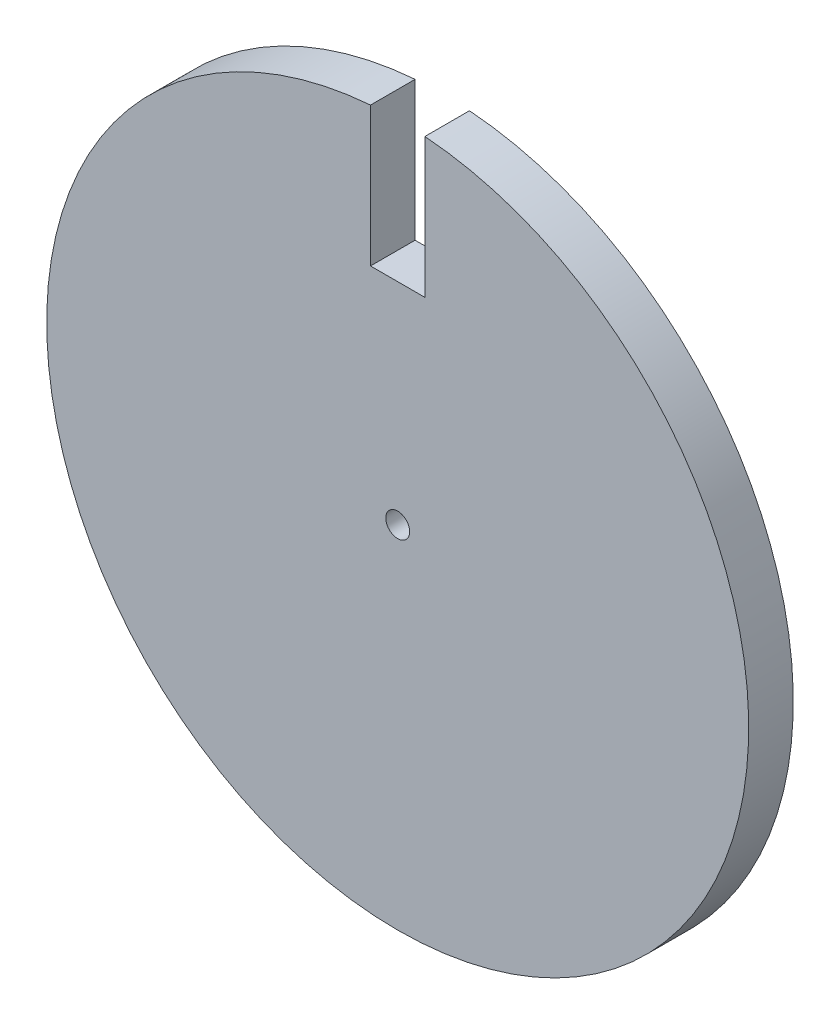
from build123d import *

# Parameters (mm, degrees)
SKETCH1_R           = 25
SKETCH1_R_2         = 0.85
BOSS_EXTRUDE1_DEPTH = 3.175
CUT_EXTRUDE1_REACH  = 37.498
SKETCH2_W           = 3.873993702
SKETCH2_H           = 19.044786736


with BuildPart() as part:
    # Sketch1 → Boss-Extrude1 (new body)
    with BuildSketch(Plane.XY):
        Circle(SKETCH1_R)
        Circle(SKETCH1_R_2, mode=Mode.SUBTRACT)
    extrude(amount=BOSS_EXTRUDE1_DEPTH)

    # Sketch2 → Cut-Extrude1 (cut, up to next)
    with BuildSketch(Plane(origin=(0, 0, 0), x_dir=(-1, 0, 0), z_dir=(0, 0, -1)), mode=Mode.PRIVATE) as cut_extrude1_sk1:
        with Locations((0, 24.522393368)):
            Rectangle(SKETCH2_W, SKETCH2_H)
    cut_extrude1_tool1 = extrude(cut_extrude1_sk1.sketch, amount=-CUT_EXTRUDE1_REACH, mode=Mode.PRIVATE) & part.part
    add(cut_extrude1_tool1.solids().sort_by_distance((0, 24.522393, 0))[0], mode=Mode.SUBTRACT)


solid = part.part
